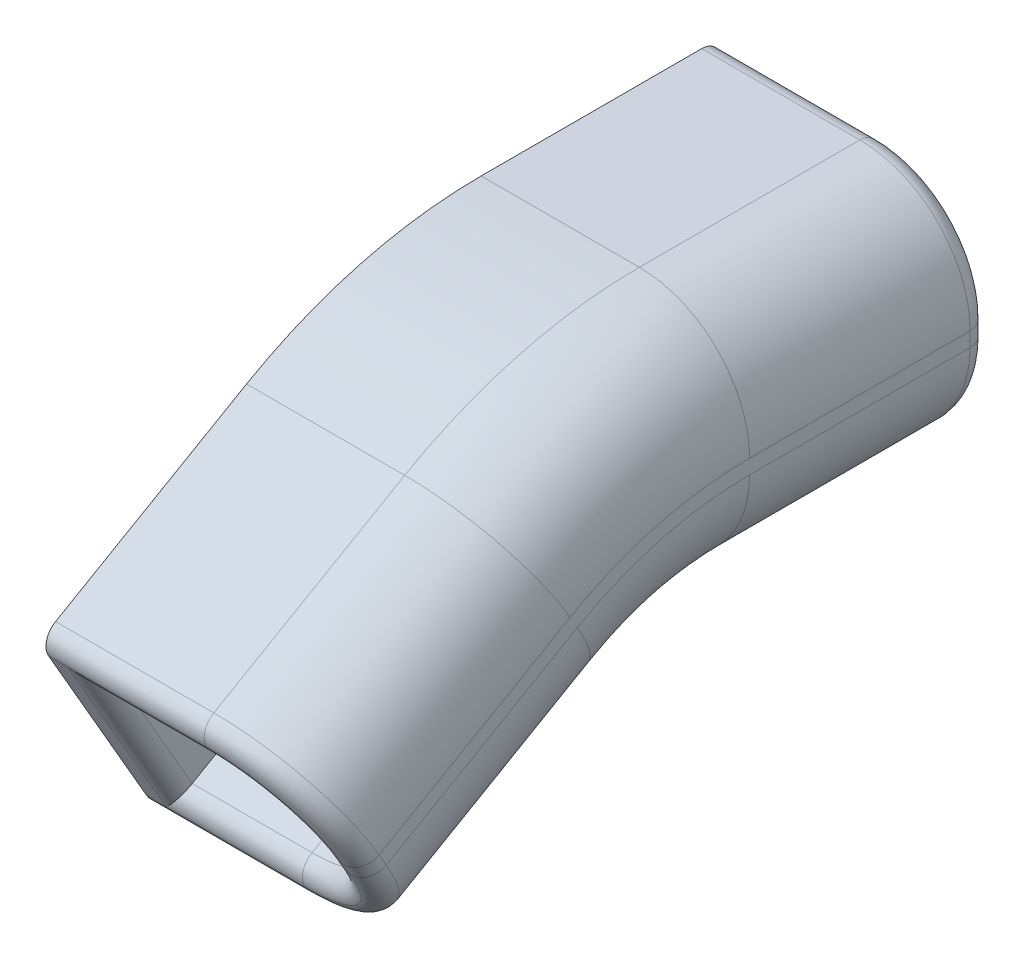
from build123d import *

# Parameters (mm, degrees)
CUT_EXTRUDE1_DEPTH = 10
CUT_EXTRUDE2_DEPTH = 10
FILLET1_R          = 0.8


with BuildPart() as part:
    # Sweep1: sweep along a path in Sketch2
    with BuildLine(Plane(origin=(0, 0, 0), x_dir=(0, 0, -1), z_dir=(1, 0, 0))) as sweep1_path:
        Line((0, 0), (-10, 0))
        ThreePointArc((-10, 0), (-13.799332082, -0.500191558), (-17.339745962, -1.966679003))
        Line((-17.339745962, -1.966679003), (-26, -6.966679003))
    # Sketch1 → Sweep1 (sweep)
    with BuildSketch(Plane.XY):
        with BuildLine():
            Line((-5.6, 4.9), (1, 4.9))
            ThreePointArc((1, 4.9), (4.252691193, 3.552691193), (5.6, 0.3))
            Line((5.6, 0.3), (5.6, -0.3))
            ThreePointArc((5.6, -0.3), (4.252691193, -3.552691193), (1, -4.9))
            Line((1, -4.9), (-5.6, -4.9))
            Line((-5.6, -4.9), (-5.6, 4.9))
        make_face()
        Polygon((2.655811238, 0), (1.327905619, 2.3), (-1.327905619, 2.3), (-2.655811238, 0), (-1.327905619, -2.3), (1.327905619, -2.3), align=None, mode=Mode.SUBTRACT)
    sweep(path=sweep1_path.line)

    # Sketch3 → Cut-Extrude1 (cut)
    with BuildSketch(Plane(origin=(0, 0, 0), x_dir=(-1, 0, 0), z_dir=(0, 0, -1))):
        with BuildLine():
            Line((4, -3.3), (4, 3.3))
            Line((4, 3.3), (-1, 3.3))
            ThreePointArc((-1, 3.3), (-3.121320344, 2.421320344), (-4, 0.3))
            Line((-4, 0.3), (-4, -0.3))
            ThreePointArc((-4, -0.3), (-3.121320344, -2.421320344), (-1, -3.3))
            Line((-1, -3.3), (4, -3.3))
        make_face()
    extrude(amount=-CUT_EXTRUDE1_DEPTH, mode=Mode.SUBTRACT)

    # Sketch4 → Cut-Extrude2 (cut)
    with BuildSketch(Plane(origin=(0, -13, 22.516660498), x_dir=(1, 0, 0), z_dir=(0, -0.5000000000000009, 0.8660254037844382))):
        with BuildLine():
            Line((-4, 10.266679003), (-4, 3.666679003))
            Line((-4, 3.666679003), (1, 3.666679003))
            ThreePointArc((1, 3.666679003), (3.121320344, 4.54535866), (4, 6.666679003))
            Line((4, 6.666679003), (4, 7.266679003))
            ThreePointArc((4, 7.266679003), (3.121320344, 9.387999347), (1, 10.266679003))
            Line((1, 10.266679003), (-4, 10.266679003))
        make_face()
    extrude(amount=-CUT_EXTRUDE2_DEPTH, mode=Mode.SUBTRACT)

    # Fillet1
    fillet1_edges = [part.edges().sort_by_distance(p)[0] for p in [
        (-1.5, -4.108795171, 27.65),
        (-4, -6.966679003, 26),
        (-1.5, -9.824562836, 24.35),
        (3.121320344, -9.063603931, 24.789339828),
        (4, -6.966679003, 26),
        (3.121320344, -4.869754075, 27.210660172),
        (-2.3, 4.9, 0),
        (4.252691193, 3.552691193, 0),
        (5.6, 0, 0),
        (4.252691193, -3.552691193, 0),
        (-2.3, -4.9, 0),
        (-2.3, -2.723154525, 28.45),
        (4.252691193, -3.889958178, 27.776345597),
        (5.6, -6.966679003, 26),
        (4.252691193, -10.043399829, 24.223654403),
        (-2.3, -11.210203482, 23.55),
        (-1.5, -3.3, 0),
        (-4, 0, 0),
        (-1.5, 3.3, 0),
        (3.121320344, 2.421320344, 0),
        (4, 0, 0),
        (3.121320344, -2.421320344, 0),
    ]]
    fillet(fillet1_edges, radius=FILLET1_R - 0.0001)  # a hair under: the kernel refuses the full size


solid = part.part
